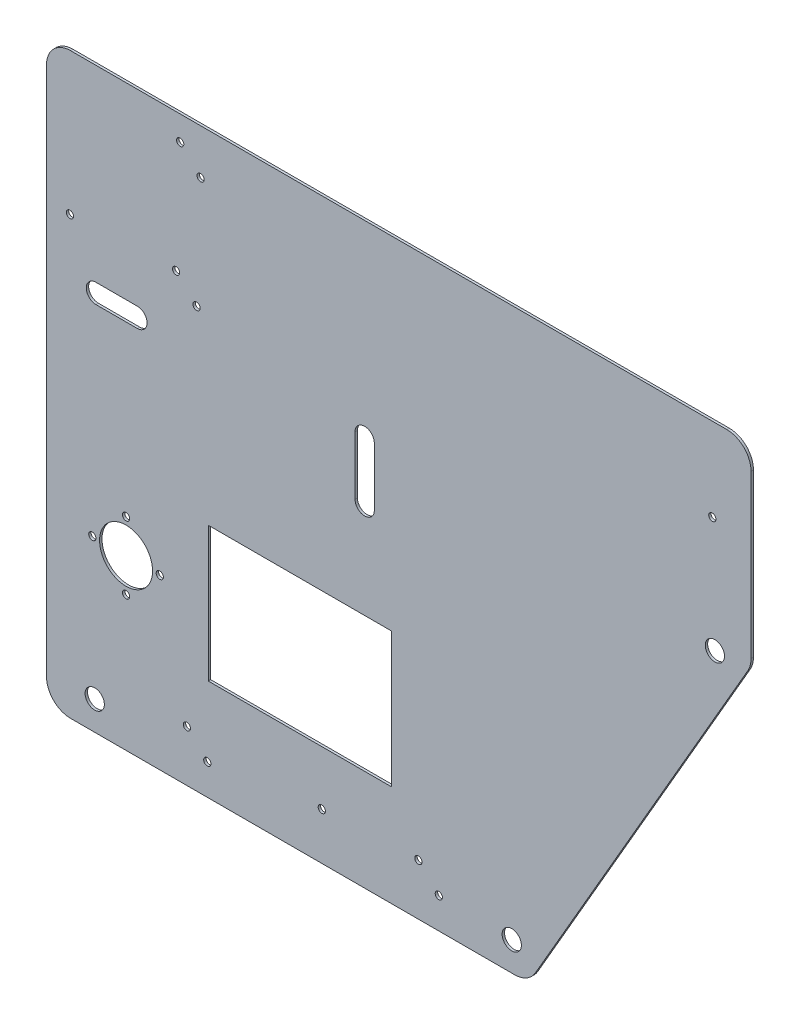
from build123d import *

# Parameters (mm, degrees)
BOSS_EXTRUDE1_DEPTH = 1
SKETCH2_R           = 4
SKETCH2_R_2         = 11
SKETCH2_R_3         = 1.5
SKETCH2_W           = 76
SKETCH2_H           = 56
CUT_EXTRUDE1_DEPTH  = 3
SKETCH3_W           = 292.37604307
SKETCH3_H           = 50
BOSS_EXTRUDE2_DEPTH = 1
FILLET1_R           = 10
SKETCH4_R           = 1.5
CUT_EXTRUDE2_DEPTH  = 11


with BuildPart() as part:
    # Sketch1 → Boss-Extrude1 (new body)
    with BuildSketch(Plane.XY):
        Polygon((-100, 110), (-100, -80), (100, -80), (192.37604307, 80), (192.37604307, 110), align=None)
    extrude(amount=BOSS_EXTRUDE1_DEPTH)

    # Sketch2 → Cut-Extrude1 (cut)
    with BuildSketch(Plane.XY.offset(1)):
        with Locations((93.07179677, -68)):
            Circle(SKETCH2_R)
        with Locations((177.364936071, 78)):
            Circle(SKETCH2_R)
        with Locations((-67, -10)):
            Circle(SKETCH2_R_2)
        with Locations((-80, -68)):
            Circle(SKETCH2_R)
        with Locations((-53, -10)):
            Circle(SKETCH2_R_3)
        with Locations((-67, 4)):
            Circle(SKETCH2_R_3)
        with Locations((-81, -10)):
            Circle(SKETCH2_R_3)
        with Locations((-67, -24)):
            Circle(SKETCH2_R_3)
        with Locations((62.79605759, -67.242640687)):
            Circle(SKETCH2_R_3)
        with Locations((54.310776216, -58.757359313)):
            Circle(SKETCH2_R_3)
        with Locations((-33.274226936, -67.242640687)):
            Circle(SKETCH2_R_3)
        with Locations((-41.75950831, -58.757359313)):
            Circle(SKETCH2_R_3)
        with Locations((14.225855729, -60.5)):
            Circle(SKETCH2_R_3)
        with Locations((-37.754710439, 94.281704345)):
            Circle(SKETCH2_R_3)
        with Locations((-46.239991813, 102.76698572)):
            Circle(SKETCH2_R_3)
        with Locations((-90.295627115, 101.024345032)):
            Circle(SKETCH2_R_3)
        with Locations((176.305585362, 125.488938255)):
            Circle(SKETCH2_R_3)
        with BuildLine():
            Line((-79.516586773, 82), (-62.300333374, 82))
            ThreePointArc((-62.300333374, 82), (-58.300333374, 78), (-62.300333374, 74))
            Line((-62.300333374, 74), (-79.516586773, 74))
            ThreePointArc((-79.516586773, 74), (-83.516586773, 78), (-79.516586773, 82))
        make_face()
        with Locations((5.141640745, -10)):
            Rectangle(SKETCH2_W, SKETCH2_H)
        with BuildLine():
            Line((36.026164778, 82), (36.026164778, 57.777585682))
            ThreePointArc((36.026164778, 57.777585682), (32.026164778, 53.777585682), (28.026164778, 57.777585682))
            Line((28.026164778, 57.777585682), (28.026164778, 82))
            ThreePointArc((28.026164778, 82), (32.026164778, 86), (36.026164778, 82))
        make_face()
    extrude(amount=-CUT_EXTRUDE1_DEPTH, mode=Mode.SUBTRACT)

    # Sketch3 → Boss-Extrude2 (add)
    with BuildSketch(Plane.XY.offset(1)):
        with Locations((46.188021535, 135)):
            Rectangle(SKETCH3_W, SKETCH3_H)
    extrude(amount=-BOSS_EXTRUDE2_DEPTH)

    # Fillet1
    fillet1_edges = [part.edges().sort_by_distance(p)[0] for p in [
        (100, -80, 0.5),
        (-100, -80, 0.5),
        (-100, 160, 0.5),
        (192.37604307, 160, 0.5),
        (192.37604307, 80, 0.5),
    ]]
    fillet(fillet1_edges, radius=FILLET1_R)

    # Sketch4 → Cut-Extrude2 (cut)
    with BuildSketch(Plane.XY.offset(1)):
        with Locations((-44.536251941, 149.829445902)):
            Circle(SKETCH4_R)
        with Locations((-36.050970567, 141.344164528)):
            Circle(SKETCH4_R)
        with Locations((176.305585362, 125.488938255)):
            Circle(SKETCH4_R)
    extrude(amount=-CUT_EXTRUDE2_DEPTH, mode=Mode.SUBTRACT)


solid = part.part
